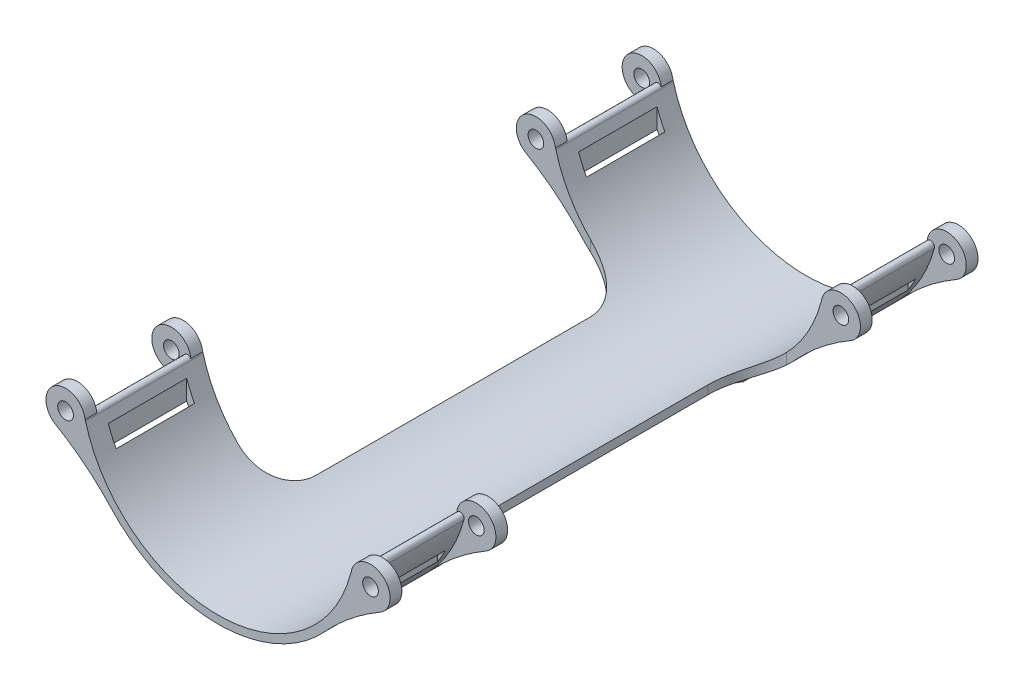
from build123d import *

# Parameters (mm, degrees)
BOSS_EXTRUDE1_DEPTH    = 150
SKETCH2_W              = 40.109469753
SKETCH2_H              = 90
SKETCH2_W_2            = 2
SKETCH2_H_2            = 20
CUT_EXTRUDE1_DEPTH     = 120
SKETCH3_R              = 5
SKETCH3_R_2            = 2
BOSS_EXTRUDE2_DEPTH    = 3
BOSS_EXTRUDE3_START    = -3
SKETCH4_R              = 5
SKETCH4_R_2            = 2
BOSS_EXTRUDE3_DEPTH    = 3
LPATTERN1_COUNT        = 2
LPATTERN1_PITCH        = 120
FILLET1_R              = 60
BOSS_EXTRUDE4_DEPTH    = 1
FILLET2_R              = 20
LPATTERN2_COUNT        = 2
LPATTERN2_PITCH        = 90
FILLET2_OF_LPATTERN2_R = 20
FILLET3_R              = 10


with BuildPart() as part:
    # Sketch1 → Boss-Extrude1 (new body)
    with BuildSketch(Plane.XY):
        with BuildLine():
            ThreePointArc((33.80740392, -9.058666579), (0, -35), (-33.80740392, -9.058666579))
            ThreePointArc((-33.80740392, -9.058666579), (-35.032148792, -8.351559797), (-35.739255573, -9.576304669))
            ThreePointArc((-35.739255573, -9.576304669), (0, -37), (35.739255573, -9.576304669))
            ThreePointArc((35.739255573, -9.576304669), (35.032148792, -8.351559797), (33.80740392, -9.058666579))
        make_face()
    extrude(amount=BOSS_EXTRUDE1_DEPTH)

    # Sketch2 → Cut-Extrude1 (cut)
    with BuildSketch(Plane(origin=(0, 0, 0), x_dir=(1, 0, 0), z_dir=(0, 1, 0))):
        with Locations((-35.054734877, -75)):
            Rectangle(SKETCH2_W, SKETCH2_H)
        with Locations((35.054734877, -75)):
            Rectangle(SKETCH2_W, SKETCH2_H)
        with Locations((32, -15)):
            Rectangle(SKETCH2_W_2, SKETCH2_H_2)
        with Locations((-32, -15)):
            Rectangle(SKETCH2_W_2, SKETCH2_H_2)
        with Locations((-32, -135)):
            Rectangle(SKETCH2_W_2, SKETCH2_H_2)
        with Locations((32, -135)):
            Rectangle(SKETCH2_W_2, SKETCH2_H_2)
    extrude(amount=-CUT_EXTRUDE1_DEPTH, mode=Mode.SUBTRACT)

    # Sketch3 → Boss-Extrude2 (add)
    # profile 1 of 2: a face of its own
    with BuildSketch(Plane(origin=(0, 0, 0), x_dir=(-1, 0, 0), z_dir=(0, 0, -1))):
        with Locations((-38.899671742, -9.317485624)):
            Circle(SKETCH3_R)
        with Locations((-38.899671742, -9.317485624)):
            Circle(SKETCH3_R_2, mode=Mode.SUBTRACT)
    # profile 2 of 2: a face of its own
    with BuildSketch(Plane(origin=(0, 0, 0), x_dir=(-1, 0, 0), z_dir=(0, 0, -1))):
        with Locations((38.899671742, -9.317485624)):
            Circle(SKETCH3_R)
        with Locations(Location((38.899671742, -9.317485624, 0), (0, 0, 180))):
            Circle(SKETCH3_R_2, mode=Mode.SUBTRACT)
    boss_extrude2 = extrude(amount=-BOSS_EXTRUDE2_DEPTH)

    # Sketch4 → Boss-Extrude3 (add)
    # profile 1 of 2: a face of its own
    with BuildSketch(Plane.XY.offset(30).offset(BOSS_EXTRUDE3_START)):
        with Locations((-38.899671742, -9.317485624)):
            Circle(SKETCH4_R)
        with Locations((-38.899671742, -9.317485624)):
            Circle(SKETCH4_R_2, mode=Mode.SUBTRACT)
    # profile 2 of 2: a face of its own
    with BuildSketch(Plane.XY.offset(30).offset(BOSS_EXTRUDE3_START)):
        with Locations((38.899671742, -9.317485624)):
            Circle(SKETCH4_R)
        with Locations(Location((38.899671742, -9.317485624, 0), (0, 0, 180))):
            Circle(SKETCH4_R_2, mode=Mode.SUBTRACT)
    boss_extrude3 = extrude(amount=BOSS_EXTRUDE3_DEPTH)

    # LPattern1: Boss-Extrude2, Boss-Extrude3 ×2
    with Locations(*[(0, 0, i * LPATTERN1_PITCH) for i in range(1, LPATTERN1_COUNT)]):
        add(boss_extrude2)
        add(boss_extrude3)

    # Fillet1
    fillet1_edges = [part.edges().sort_by_distance(p)[0] for p in [
        (34.892782732, -12.308278238, 1.5),
        (-34.892782732, -12.308278238, 1.5),
        (-34.892782732, -12.308278238, 28.5),
        (34.892782732, -12.308278238, 28.5),
        (34.892782732, -12.308278238, 121.5),
        (-34.892782732, -12.308278238, 121.5),
        (-34.892782732, -12.308278238, 148.5),
        (34.892782732, -12.308278238, 148.5),
    ]]
    fillet(fillet1_edges, radius=FILLET1_R)

    # Sketch5 → Boss-Extrude4 (add, symmetric)
    with BuildSketch(Plane(origin=(0, 0, 120), x_dir=(-1, 0, 0), z_dir=(0, 0, -1))):
        with BuildLine():
            Line((15, -35.457721303), (15, -34.166982403))
            Line((15, -34.166982403), (15, -31.622776602))
            ThreePointArc((15, -31.622776602), (0, -35), (-15, -31.622776602))
            Line((-15, -31.622776602), (-15, -33.823069051))
            Line((-15, -33.823069051), (-15, -33.951934532))
            Line((-15, -33.951934532), (-15, -35.457721303))
            ThreePointArc((-15, -35.457721303), (0, -38.5), (15, -35.457721303))
        make_face()
    boss_extrude4 = extrude(amount=BOSS_EXTRUDE4_DEPTH, both=True)

    # Fillet2
    # the kernel refuses this fillet: 20 mm, written as the material it adds along each edge
    with BuildSketch(Plane(origin=(0, 0, 121), x_dir=(0.802187271950027, -0.5970725087636956, 0), z_dir=(0.5970725087636956, 0.802187271950027, 0))) as fillet2_piece_1_section:
        with BuildLine():
            CenterArc((57, -7.599342077), FILLET2_R, 157.668354991, 22.331645009)
            Line((38.5, 0), (38.13, 0.151986842))
            ThreePointArc((38.13, 0.151986842), (37.75, 0.4), (37, 0.4))
            Line((37, 0.4), (36.6, 0))
            Line((36.6, 0), (36.6, -7.599342077))
            Line((36.6, -7.599342077), (37, -7.599342077))
        make_face()
    fillet2_piece_1 = revolve(axis=Axis((0, 0, 121), (0, 0, -1)), revolution_arc=106.67896401, mode=Mode.PRIVATE)
    fillet2_piece_1 = split(fillet2_piece_1, bisect_by=Plane(origin=(-15, -37.318777993, 124.714554063), z_dir=(1, 0, 0)), keep=Keep.TOP, mode=Mode.PRIVATE)
    fillet2_piece_1 = split(fillet2_piece_1, bisect_by=Plane(origin=(15, -37.318777993, 124.714554063), z_dir=(-1, 0, 0)), keep=Keep.TOP, mode=Mode.PRIVATE)
    add(fillet2_piece_1)
    with BuildSketch(Plane(origin=(0, 0, 119), x_dir=(0.802187271950027, -0.5970725087636956, 0), z_dir=(0.5970725087636956, 0.802187271950027, 0))) as fillet2_piece_2_section:
        with BuildLine():
            CenterArc((57, 7.599342077), FILLET2_R, 180, 22.331645009)
            Line((37, 7.599342077), (36.6, 7.599342077))
            Line((36.6, 7.599342077), (36.6, 0))
            Line((36.6, 0), (37, -0.4))
            ThreePointArc((37, -0.4), (37.75, -0.4), (38.13, -0.151986842))
            Line((38.13, -0.151986842), (38.5, 0))
        make_face()
    fillet2_piece_2 = revolve(axis=Axis((0, 0, 119), (0, 0, -1)), revolution_arc=106.67896401, mode=Mode.PRIVATE)
    fillet2_piece_2 = split(fillet2_piece_2, bisect_by=Plane(origin=(-15, -37.318777993, 115.285445937), z_dir=(1, 0, 0)), keep=Keep.TOP, mode=Mode.PRIVATE)
    fillet2_piece_2 = split(fillet2_piece_2, bisect_by=Plane(origin=(15, -37.318777993, 115.285445937), z_dir=(-1, 0, 0)), keep=Keep.TOP, mode=Mode.PRIVATE)
    add(fillet2_piece_2)

    # LPattern2: Boss-Extrude4 ×2
    with Locations(*[(0, 0, -i * LPATTERN2_PITCH) for i in range(1, LPATTERN2_COUNT)]):
        add(boss_extrude4)

    # Fillet2 of LPattern2
    # the kernel refuses this fillet: 20 mm, written as the material it adds along each edge
    with BuildSketch(Plane(origin=(0, 0, 31), x_dir=(0.802187271950026, -0.597072508763697, 0), z_dir=(0.597072508763697, 0.802187271950026, 0))) as fillet2_of_lpattern2_piece_1_section:
        with BuildLine():
            CenterArc((57, -7.599342077), FILLET2_OF_LPATTERN2_R, 157.668354991, 22.331645009)
            Line((38.5, 0), (38.13, 0.151986842))
            ThreePointArc((38.13, 0.151986842), (37.75, 0.4), (37, 0.4))
            Line((37, 0.4), (36.6, 0))
            Line((36.6, 0), (36.6, -7.599342077))
            Line((36.6, -7.599342077), (37, -7.599342077))
        make_face()
    fillet2_of_lpattern2_piece_1 = revolve(axis=Axis((0, 0, 31), (0, 0, -1)), revolution_arc=106.67896401, mode=Mode.PRIVATE)
    fillet2_of_lpattern2_piece_1 = split(fillet2_of_lpattern2_piece_1, bisect_by=Plane(origin=(15, -37.318777993, 34.714554063), z_dir=(-1, 0, 0)), keep=Keep.TOP, mode=Mode.PRIVATE)
    fillet2_of_lpattern2_piece_1 = split(fillet2_of_lpattern2_piece_1, bisect_by=Plane(origin=(-15, -37.318777993, 34.714554063), z_dir=(1, 0, 0)), keep=Keep.TOP, mode=Mode.PRIVATE)
    add(fillet2_of_lpattern2_piece_1)
    with BuildSketch(Plane(origin=(0, 0, 29), x_dir=(0.8021872719500256, -0.5970725087636976, 0), z_dir=(0.5970725087636976, 0.8021872719500256, 0))) as fillet2_of_lpattern2_piece_2_section:
        with BuildLine():
            CenterArc((57, 7.599342077), FILLET2_OF_LPATTERN2_R, 180, 22.331645009)
            Line((37, 7.599342077), (36.6, 7.599342077))
            Line((36.6, 7.599342077), (36.6, 0))
            Line((36.6, 0), (37, -0.4))
            ThreePointArc((37, -0.4), (37.75, -0.4), (38.13, -0.151986842))
            Line((38.13, -0.151986842), (38.5, 0))
        make_face()
    fillet2_of_lpattern2_piece_2 = revolve(axis=Axis((0, 0, 29), (0, 0, -1)), revolution_arc=106.67896401, mode=Mode.PRIVATE)
    fillet2_of_lpattern2_piece_2 = split(fillet2_of_lpattern2_piece_2, bisect_by=Plane(origin=(-15, -37.318777993, 25.285445937), z_dir=(1, 0, 0)), keep=Keep.TOP, mode=Mode.PRIVATE)
    fillet2_of_lpattern2_piece_2 = split(fillet2_of_lpattern2_piece_2, bisect_by=Plane(origin=(15, -37.318777993, 25.285445937), z_dir=(-1, 0, 0)), keep=Keep.TOP, mode=Mode.PRIVATE)
    add(fillet2_of_lpattern2_piece_2)

    # Fillet3
    # the kernel refuses this fillet: 10 mm, written as the material it adds along each edge
    with BuildSketch(Plane(origin=(15, -6.622776602, 120), x_dir=(1, 0, 0), z_dir=(0, -1, 0))) as fillet3_piece_1_section:
        with BuildLine():
            CenterArc((FILLET3_R, -FILLET3_R), FILLET3_R, 90, 90)
            Line((0, -FILLET3_R), (0, 0))
            Line((0, 0), (FILLET3_R, 0))
        make_face()
    fillet3_piece_1 = extrude(amount=52.200292449, mode=Mode.PRIVATE)
    fillet3_piece_1 = fillet3_piece_1 - Plane(origin=(0, 0, 117.805122466), x_dir=(0.9659258262890681, -0.25881904510252157, 0), z_dir=(0, 0, -1)) * Cylinder(35, 145, mode=Mode.PRIVATE)
    fillet3_piece_1 = fillet3_piece_1 & Plane(origin=(0, 0, 117.805122466), x_dir=(-0.9659258262890681, -0.25881904510252135, 0), z_dir=(0, 0, -1)) * Cylinder(37, 145, mode=Mode.PRIVATE)
    add(fillet3_piece_1)
    with BuildSketch(Plane(origin=(15, -6.622776602, 30), x_dir=(1, 0, 0), z_dir=(0, -1, 0))) as fillet3_piece_2_section:
        with BuildLine():
            CenterArc((FILLET3_R, FILLET3_R), FILLET3_R, 180, 90)
            Line((0, FILLET3_R), (0, 0))
            Line((0, 0), (FILLET3_R, 0))
        make_face()
    fillet3_piece_2 = extrude(amount=52.200292449, mode=Mode.PRIVATE)
    fillet3_piece_2 = fillet3_piece_2 & Plane(origin=(0, 0, 32.194877534), x_dir=(-0.9659258262890681, -0.25881904510252135, 0), z_dir=(0, 0, -1)) * Cylinder(37, 145, mode=Mode.PRIVATE)
    fillet3_piece_2 = fillet3_piece_2 - Plane(origin=(0, 0, 32.194877534), x_dir=(0.9659258262890681, -0.25881904510252157, 0), z_dir=(0, 0, -1)) * Cylinder(35, 145, mode=Mode.PRIVATE)
    add(fillet3_piece_2)
    with BuildSketch(Plane(origin=(-15, -6.622776602, 30), x_dir=(-1, 0, 0), z_dir=(0, -1, 0))) as fillet3_piece_3_section:
        with BuildLine():
            CenterArc((FILLET3_R, -FILLET3_R), FILLET3_R, 90, 90)
            Line((0, -FILLET3_R), (0, 0))
            Line((0, 0), (FILLET3_R, 0))
        make_face()
    fillet3_piece_3 = extrude(amount=52.200292449, mode=Mode.PRIVATE)
    fillet3_piece_3 = fillet3_piece_3 & Plane(origin=(0, 0, 32.194882502), x_dir=(-0.9659258262890681, -0.25881904510252135, 0), z_dir=(0, 0, -1)) * Cylinder(37, 145, mode=Mode.PRIVATE)
    fillet3_piece_3 = fillet3_piece_3 - Plane(origin=(0, 0, 32.194882502), x_dir=(0.9659258262890681, -0.25881904510252157, 0), z_dir=(0, 0, -1)) * Cylinder(35, 145, mode=Mode.PRIVATE)
    add(fillet3_piece_3)
    with BuildSketch(Plane(origin=(-15, -6.622776602, 120), x_dir=(-1, 0, 0), z_dir=(0, -1, 0))) as fillet3_piece_4_section:
        with BuildLine():
            CenterArc((FILLET3_R, FILLET3_R), FILLET3_R, 180, 90)
            Line((0, FILLET3_R), (0, 0))
            Line((0, 0), (FILLET3_R, 0))
        make_face()
    fillet3_piece_4 = extrude(amount=52.200292449, mode=Mode.PRIVATE)
    fillet3_piece_4 = fillet3_piece_4 - Plane(origin=(0, 0, 117.805117498), x_dir=(0.9659258262890681, -0.25881904510252157, 0), z_dir=(0, 0, -1)) * Cylinder(35, 145, mode=Mode.PRIVATE)
    fillet3_piece_4 = fillet3_piece_4 & Plane(origin=(0, 0, 117.805117498), x_dir=(-0.9659258262890681, -0.25881904510252135, 0), z_dir=(0, 0, -1)) * Cylinder(37, 145, mode=Mode.PRIVATE)
    add(fillet3_piece_4)


solid = part.part
